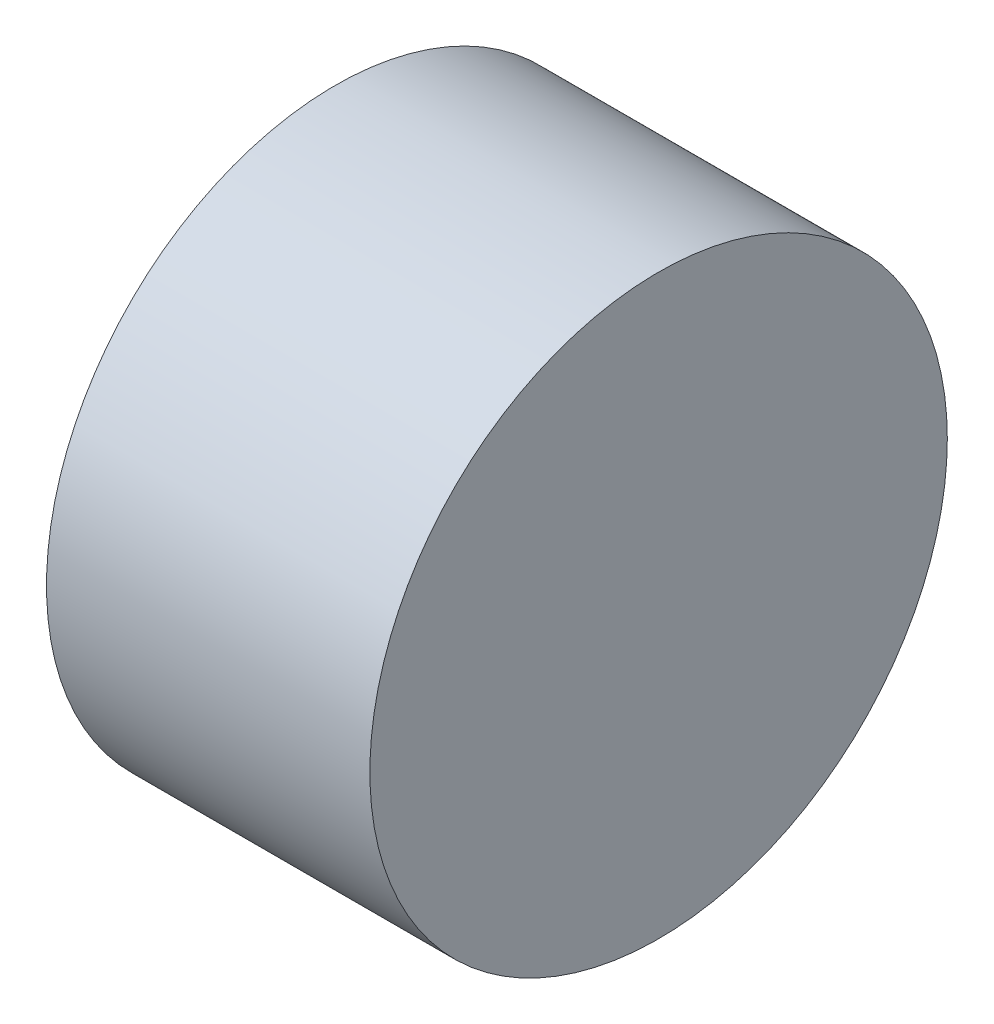
from build123d import *

# Parameters (mm, degrees)
SKETCH1_R           = 5
BOSS_EXTRUDE1_DEPTH = 5.6


with BuildPart() as part:
    # Sketch1 → Boss-Extrude1 (new body)
    with BuildSketch(Plane(origin=(0, 0, 0), x_dir=(0, 0, -1), z_dir=(1, 0, 0))):
        Circle(SKETCH1_R)
    extrude(amount=BOSS_EXTRUDE1_DEPTH)


solid = part.part
